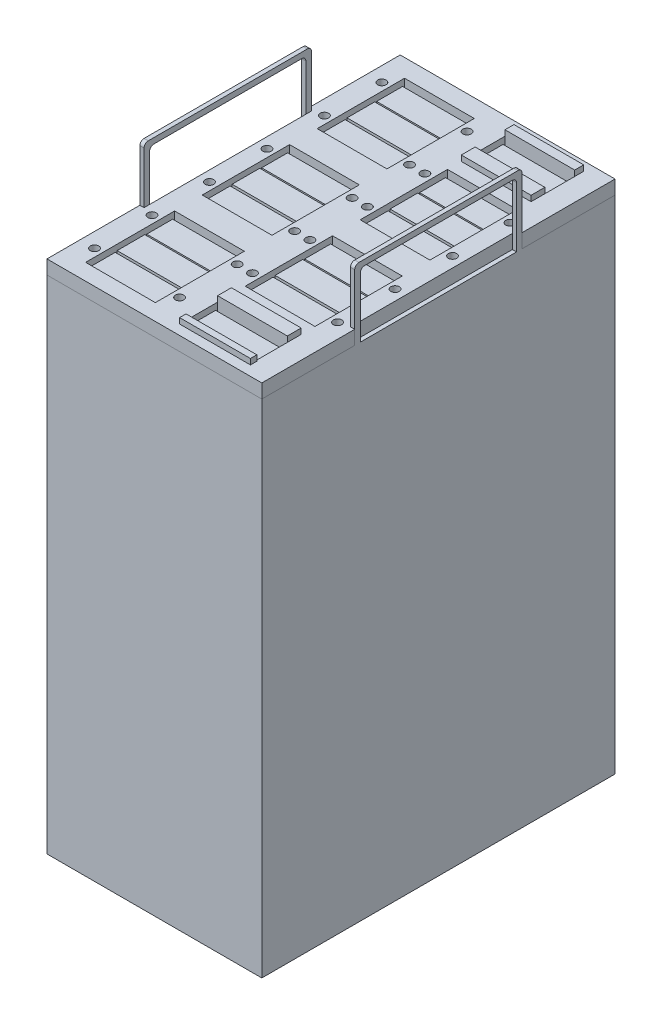
from build123d import *

# Parameters (mm, degrees)
SKETCH1_W                  = 77
SKETCH1_H                  = 126.6
SKETCH1_W_2                = 74
SKETCH1_H_2                = 123.6
BASE_BODY_DEPTH            = 179.7
SKETCH1_4_W                = 74
SKETCH1_4_H                = 123.6
BASE_FLOOR_DEPTH           = 2
FLOOR_HOLE_S_W             = 66.6
FLOOR_HOLE_S_H             = 116.2
FLOOR_HOLE_DEPTH           = 16
SKETCH2_W                  = 11
SKETCH2_H                  = 4.95
SKETCH2_H_2                = 4.35
SKETCH2_H_3                = 1.5
BOSS_EXTRUDE1_DEPTH        = 5
SKETCH2_3_W                = 11
SKETCH2_3_H                = 4.95
SKETCH2_3_H_2              = 4.35
BOSS_EXTRUDE2_DEPTH        = 5.7
SKETCH2_4_W                = 25
SKETCH2_4_H                = 9.3
BOSS_EXTRUDE3_DEPTH        = 2.8
LPATTERN2_COUNT            = 6
LPATTERN2_PITCH            = 20.6
LPATTERN2_2_COUNT          = 2
LPATTERN2_2_PITCH          = 36
SKETCH2_6_W                = 25
SKETCH2_6_H                = 9.9
BOSS_EXTRUDE4_DEPTH        = 5
LPATTERN3_COUNT            = 5
LPATTERN3_PITCH            = 20.6
LPATTERN3_2_COUNT          = 2
LPATTERN3_2_PITCH          = 36
SKETCH6_W                  = 25
SKETCH6_H                  = 9.9
CUT_EXTRUDE2_DEPTH         = 2
BOSS_EXTRUDE13_OUTLINE_W   = 25
BOSS_EXTRUDE13_OUTLINE_H   = 4.95
BOSS_EXTRUDE13_OUTLINE_W_2 = 25.382374023
BOSS_EXTRUDE13_OUTLINE_H_2 = 2.3
BOSS_EXTRUDE13_OUTLINE_H_3 = 3.225
BOSS_EXTRUDE13_DEPTH       = 2
CUT_EXTRUDE3_DEPTH         = 45
LPATTERN4_COUNT            = 6
LPATTERN4_PITCH            = 20.6
LPATTERN5_COUNT            = 2
LPATTERN5_PITCH            = 36
LPATTERN5_COUNT_DIR2       = 6
LPATTERN5_PITCH_DIR2       = 20.6
SKETCH11_3_R               = 1.5
BOSS_EXTRUDE14_DEPTH       = 10.7
SKETCH12_R                 = 1.5
BOSS_EXTRUDE15_DEPTH       = 10.8
SKETCH14_W                 = 1.5
SKETCH14_H                 = 2
BOSS_EXTRUDE16_DEPTH       = 25
SKETCH15_W                 = 1.5
SKETCH15_H                 = 2
BOSS_EXTRUDE17_DEPTH       = 56
FILLET2_R                  = 1.5
SKETCH16_W                 = 1.5
SKETCH16_H                 = 60
CUT_EXTRUDE4_DEPTH         = 5


# Read off the part's stored shape, not the designer's step: Boss-Extrude13
with BuildPart() as part:
    # Sketch1 → Base Body (new body)
    with BuildSketch(Plane(origin=(0, 0, 0), x_dir=(1, 0, 0), z_dir=(0, 1, 0))):
        with Locations((-26.13968254, -14.066666667)):
            Rectangle(SKETCH1_W, SKETCH1_H)
        with Locations((-26.13968254, -14.066666667)):
            Rectangle(SKETCH1_W_2, SKETCH1_H_2, mode=Mode.SUBTRACT)
    extrude(amount=BASE_BODY_DEPTH)

    # Sketch1<4> → Base Floor (add)
    with BuildSketch(Plane(origin=(0, 0, 0), x_dir=(1, 0, 0), z_dir=(0, 1, 0))):
        with Locations((-26.13968254, -14.066666667)):
            Rectangle(SKETCH1_4_W, SKETCH1_4_H)
    extrude(amount=BASE_FLOOR_DEPTH)

    # Floor Hole-S → Floor Hole (cut)
    with BuildSketch(Plane.XZ):
        with Locations((-26.13968254, 14.066666667)):
            Rectangle(FLOOR_HOLE_S_W, FLOOR_HOLE_S_H)
    extrude(amount=-FLOOR_HOLE_DEPTH, mode=Mode.SUBTRACT)

    # Sketch14 → Boss-Extrude16 (add)
    with BuildSketch(Plane(origin=(0, 179.7, 0), x_dir=(1, 0, 0), z_dir=(0, 1, 0))):
        with Locations((11.61031746, 14.933333333)):
            Rectangle(SKETCH14_W, SKETCH14_H)
        with Locations((11.61031746, -43.066666667)):
            Rectangle(SKETCH14_W, SKETCH14_H)
        with Locations((-63.88968254, 14.933333333)):
            Rectangle(SKETCH14_W, SKETCH14_H)
        with Locations((-63.88968254, -43.066666667)):
            Rectangle(SKETCH14_W, SKETCH14_H)
    extrude(amount=BOSS_EXTRUDE16_DEPTH)

    # Sketch15 → Boss-Extrude17 (add)
    with BuildSketch(Plane.XY.offset(-13.933333333)):
        with Locations((11.61031746, 203.7)):
            Rectangle(SKETCH15_W, SKETCH15_H)
        with Locations((-63.88968254, 203.7)):
            Rectangle(SKETCH15_W, SKETCH15_H)
    extrude(amount=BOSS_EXTRUDE17_DEPTH)

    # Fillet2
    fillet2_edges = [part.edges().sort_by_distance(p)[0] for p in [
        (11.61031746, 204.7, -15.933333333),
        (11.61031746, 204.7, 44.066666667),
        (-63.88968254, 204.7, -15.933333333),
        (-63.88968254, 204.7, 44.066666667),
        (11.61031746, 202.7, -13.933333333),
        (11.61031746, 202.7, 42.066666667),
        (-63.88968254, 202.7, -13.933333333),
        (-63.88968254, 202.7, 42.066666667),
    ]]
    fillet(fillet2_edges, radius=FILLET2_R)


with BuildPart() as body_2:
    # Sketch2 → Boss-Extrude1 (new body)
    with BuildSketch(Plane(origin=(0, 179.7, 0), x_dir=(1, 0, 0), z_dir=(0, 1, 0))):
        Polygon((-20.63968254, 42.783333333), (-31.63968254, 42.783333333), (-31.63968254, 42.083333333), (-31.63968254, 32.783333333), (-31.63968254, 32.083333333), (-31.63968254, 22.183333333), (-31.63968254, -71.516666667), (-20.63968254, -71.516666667), align=None)
        Polygon((10.86031746, 47.733333333), (-20.63968254, 47.733333333), (-20.63968254, 42.783333333), (4.36031746, 42.783333333), (4.36031746, -71.516666667), (-20.63968254, -71.516666667), (-20.63968254, -75.866666667), (10.86031746, -75.866666667), align=None)
        Polygon((-31.63968254, 42.783333333), (-31.63968254, 47.733333333), (-63.13968254, 47.733333333), (-63.13968254, -75.866666667), (-31.63968254, -75.866666667), (-31.63968254, -71.516666667), (-56.63968254, -71.516666667), (-56.63968254, 22.183333333), (-56.63968254, 32.083333333), (-56.63968254, 32.783333333), (-56.63968254, 42.083333333), (-56.63968254, 42.783333333), align=None)
        with Locations((-26.13968254, 45.258333333)):
            Rectangle(SKETCH2_W, SKETCH2_H)
        with Locations((-26.13968254, -73.691666667)):
            Rectangle(SKETCH2_W, SKETCH2_H_2)
        Polygon((-31.63968254, 49.233333333), (-64.63968254, 49.233333333), (-64.63968254, -77.366666667), (-31.63968254, -77.366666667), (-31.63968254, -75.866666667), (-63.13968254, -75.866666667), (-63.13968254, 47.733333333), (-31.63968254, 47.733333333), align=None)
        with Locations((-26.13968254, 48.483333333)):
            Rectangle(SKETCH2_W, SKETCH2_H_3)
        Polygon((12.36031746, 49.233333333), (-20.63968254, 49.233333333), (-20.63968254, 47.733333333), (10.86031746, 47.733333333), (10.86031746, -75.866666667), (-20.63968254, -75.866666667), (-20.63968254, -77.366666667), (12.36031746, -77.366666667), align=None)
        with Locations((-26.13968254, -76.616666667)):
            Rectangle(SKETCH2_W, SKETCH2_H_3)
    extrude(amount=BOSS_EXTRUDE1_DEPTH)

    # Sketch2<3> → Boss-Extrude2 (add)
    with BuildSketch(Plane(origin=(0, 179.7, 0), x_dir=(1, 0, 0), z_dir=(0, 1, 0))):
        Polygon((-31.63968254, 42.783333333), (-31.63968254, 47.733333333), (-63.13968254, 47.733333333), (-63.13968254, -75.866666667), (-31.63968254, -75.866666667), (-31.63968254, -71.516666667), (-56.63968254, -71.516666667), (-56.63968254, 22.183333333), (-56.63968254, 32.083333333), (-56.63968254, 32.783333333), (-56.63968254, 42.083333333), (-56.63968254, 42.783333333), align=None)
        Polygon((10.86031746, 47.733333333), (-20.63968254, 47.733333333), (-20.63968254, 42.783333333), (4.36031746, 42.783333333), (4.36031746, -71.516666667), (-20.63968254, -71.516666667), (-20.63968254, -75.866666667), (10.86031746, -75.866666667), align=None)
        Polygon((-20.63968254, 42.783333333), (-31.63968254, 42.783333333), (-31.63968254, 42.083333333), (-31.63968254, 32.783333333), (-31.63968254, 32.083333333), (-31.63968254, 22.183333333), (-31.63968254, -71.516666667), (-20.63968254, -71.516666667), align=None)
        with Locations((-26.13968254, 45.258333333)):
            Rectangle(SKETCH2_3_W, SKETCH2_3_H)
        with Locations((-26.13968254, -73.691666667)):
            Rectangle(SKETCH2_3_W, SKETCH2_3_H_2)
    extrude(amount=-BOSS_EXTRUDE2_DEPTH)


with BuildPart() as body_3:
    # Sketch2<4> → Boss-Extrude3 (new body)
    with BuildSketch(Plane(origin=(0, 179.7, 0), x_dir=(1, 0, 0), z_dir=(0, 1, 0))):
        with Locations((-44.13968254, 37.433333333)):
            Rectangle(SKETCH2_4_W, SKETCH2_4_H)
    extrude(amount=BOSS_EXTRUDE3_DEPTH)


with BuildPart() as lpattern2_1:
    # LPattern2: pattern copy
    add(body_3.part.moved(Location(Vector(0, 0, 1) * (1 * LPATTERN2_PITCH))))


with BuildPart() as lpattern2_2:
    # LPattern2: pattern copy
    add(body_3.part.moved(Location(Vector(0, 0, 1) * (2 * LPATTERN2_PITCH))))


with BuildPart() as lpattern2_3:
    # LPattern2: pattern copy
    add(body_3.part.moved(Location(Vector(0, 0, 1) * (3 * LPATTERN2_PITCH))))


with BuildPart() as lpattern2_4:
    # LPattern2: pattern copy
    add(body_3.part.moved(Location(Vector(0, 0, 1) * (4 * LPATTERN2_PITCH))))


with BuildPart() as lpattern2_5:
    # LPattern2: pattern copy
    add(body_3.part.moved(Location(Vector(0, 0, 1) * (5 * LPATTERN2_PITCH))))


with BuildPart() as lpattern2_2_1:
    # LPattern2 2: pattern copy
    add(body_3.part.moved(Location(Vector(1, 0, 0) * (1 * LPATTERN2_2_PITCH))))


with BuildPart() as lpattern2_2_2:
    # LPattern2 2: pattern copy
    add(lpattern2_1.part.moved(Location(Vector(1, 0, 0) * (1 * LPATTERN2_2_PITCH))))


with BuildPart() as lpattern2_2_3:
    # LPattern2 2: pattern copy
    add(lpattern2_2.part.moved(Location(Vector(1, 0, 0) * (1 * LPATTERN2_2_PITCH))))


with BuildPart() as lpattern2_2_4:
    # LPattern2 2: pattern copy
    add(lpattern2_3.part.moved(Location(Vector(1, 0, 0) * (1 * LPATTERN2_2_PITCH))))


with BuildPart() as lpattern2_2_5:
    # LPattern2 2: pattern copy
    add(lpattern2_4.part.moved(Location(Vector(1, 0, 0) * (1 * LPATTERN2_2_PITCH))))


with BuildPart() as lpattern2_2_6:
    # LPattern2 2: pattern copy
    add(lpattern2_5.part.moved(Location(Vector(1, 0, 0) * (1 * LPATTERN2_2_PITCH))))


with BuildPart() as body_15:
    # Sketch2<6> → Boss-Extrude4 (new body)
    with BuildSketch(Plane(origin=(0, 179.7, 0), x_dir=(1, 0, 0), z_dir=(0, 1, 0))):
        with Locations((-44.13968254, 27.133333333)):
            Rectangle(SKETCH2_6_W, SKETCH2_6_H)
    extrude(amount=BOSS_EXTRUDE4_DEPTH)


with BuildPart() as lpattern3_1:
    # LPattern3: pattern copy
    add(body_15.part.moved(Location(Vector(0, 0, 1) * (1 * LPATTERN3_PITCH))))


with BuildPart() as lpattern3_2:
    # LPattern3: pattern copy
    add(body_15.part.moved(Location(Vector(0, 0, 1) * (2 * LPATTERN3_PITCH))))


with BuildPart() as lpattern3_3:
    # LPattern3: pattern copy
    add(body_15.part.moved(Location(Vector(0, 0, 1) * (3 * LPATTERN3_PITCH))))


with BuildPart() as lpattern3_4:
    # LPattern3: pattern copy
    add(body_15.part.moved(Location(Vector(0, 0, 1) * (4 * LPATTERN3_PITCH))))


with BuildPart() as lpattern3_2_1:
    # LPattern3 2: pattern copy
    add(body_15.part.moved(Location(Vector(1, 0, 0) * (1 * LPATTERN3_2_PITCH))))


with BuildPart() as lpattern3_2_2:
    # LPattern3 2: pattern copy
    add(lpattern3_1.part.moved(Location(Vector(1, 0, 0) * (1 * LPATTERN3_2_PITCH))))


with BuildPart() as lpattern3_2_3:
    # LPattern3 2: pattern copy
    add(lpattern3_2.part.moved(Location(Vector(1, 0, 0) * (1 * LPATTERN3_2_PITCH))))


with BuildPart() as lpattern3_2_4:
    # LPattern3 2: pattern copy
    add(lpattern3_3.part.moved(Location(Vector(1, 0, 0) * (1 * LPATTERN3_2_PITCH))))


with BuildPart() as lpattern3_2_5:
    # LPattern3 2: pattern copy
    add(lpattern3_4.part.moved(Location(Vector(1, 0, 0) * (1 * LPATTERN3_2_PITCH))))


with BuildPart() as cut_extrude2_tool:
    # Sketch6 → Cut-Extrude2 (new body)
    with BuildSketch(Plane(origin=(0, 184.7, 0), x_dir=(1, 0, 0), z_dir=(0, 1, 0))):
        with Locations((-44.13968254, 27.133333333)):
            Rectangle(SKETCH6_W, SKETCH6_H)
        with Locations((-8.13968254, 6.533333333)):
            Rectangle(SKETCH6_W, SKETCH6_H)
        with Locations((-44.13968254, -14.066666667)):
            Rectangle(SKETCH6_W, SKETCH6_H)
        with Locations((-8.13968254, -34.666666667)):
            Rectangle(SKETCH6_W, SKETCH6_H)
        with Locations((-44.13968254, -55.266666667)):
            Rectangle(SKETCH6_W, SKETCH6_H)
    extrude(amount=-CUT_EXTRUDE2_DEPTH)


with BuildPart() as body_15_1:
    add(body_15.part)

    # Cut-Extrude2: cut by cut_extrude2_tool
    add(cut_extrude2_tool.part, mode=Mode.SUBTRACT)


with BuildPart() as lpattern3_2_6:
    add(lpattern3_2.part)

    # Cut-Extrude2: cut by cut_extrude2_tool
    add(cut_extrude2_tool.part, mode=Mode.SUBTRACT)


with BuildPart() as lpattern3_4_1:
    add(lpattern3_4.part)

    # Cut-Extrude2: cut by cut_extrude2_tool
    add(cut_extrude2_tool.part, mode=Mode.SUBTRACT)


with BuildPart() as lpattern3_2_2_1:
    add(lpattern3_2_2.part)

    # Cut-Extrude2: cut by cut_extrude2_tool
    add(cut_extrude2_tool.part, mode=Mode.SUBTRACT)


with BuildPart() as lpattern3_2_4_1:
    add(lpattern3_2_4.part)

    # Cut-Extrude2: cut by cut_extrude2_tool
    add(cut_extrude2_tool.part, mode=Mode.SUBTRACT)


with BuildPart() as body_3_1:
    add(body_3.part)

    # Combine4: union LPattern2_1, LPattern2_2, LPattern2_3, LPattern2_4, LPattern2_5, LPattern2 2_1, LPattern2 2_2, LPattern2 2_3, LPattern2 2_4, LPattern2 2_5, LPattern2 2_6, LPattern3_1, LPattern3_3, LPattern3 2_1, LPattern3 2_3, LPattern3 2_5, body 2
    add(lpattern2_1.part)
    add(lpattern2_2.part)
    add(lpattern2_3.part)
    add(lpattern2_4.part)
    add(lpattern2_5.part)
    add(lpattern2_2_1.part)
    add(lpattern2_2_2.part)
    add(lpattern2_2_3.part)
    add(lpattern2_2_4.part)
    add(lpattern2_2_5.part)
    add(lpattern2_2_6.part)
    add(lpattern3_1.part)
    add(lpattern3_3.part)
    add(lpattern3_2_1.part)
    add(lpattern3_2_3.part)
    add(lpattern3_2_5.part)
    add(body_2.part)


with BuildPart() as lpattern3_2_7:
    add(lpattern3_2_6.part)

    # Combine5: union LPattern3_4, LPattern3 2_2, LPattern3 2_4, body 3, body 15
    add(lpattern3_4_1.part)
    add(lpattern3_2_2_1.part)
    add(lpattern3_2_4_1.part)
    add(body_3_1.part)
    add(body_15_1.part)

    # Boss-Extrude13 outline → Boss-Extrude13 (add)
    with BuildSketch(Plane(origin=(0, 184.7, 0), x_dir=(1, 0, 0), z_dir=(0, 1, 0))):
        with Locations((-8.13968254, -57.741666667)):
            Rectangle(BOSS_EXTRUDE13_OUTLINE_W, BOSS_EXTRUDE13_OUTLINE_H)
        with Locations((-8.13968254, 29.608333333)):
            Rectangle(BOSS_EXTRUDE13_OUTLINE_W, BOSS_EXTRUDE13_OUTLINE_H)
        with Locations((-7.948495529, -72.666666667)):
            Rectangle(BOSS_EXTRUDE13_OUTLINE_W_2, BOSS_EXTRUDE13_OUTLINE_H_2)
        with Locations((-8.13968254, 44.395833333)):
            Rectangle(BOSS_EXTRUDE13_OUTLINE_W, BOSS_EXTRUDE13_OUTLINE_H_3)
    extrude(amount=BOSS_EXTRUDE13_DEPTH)

    # Sketch11 → Cut-Extrude3 (cut)
    with BuildSketch(Plane.XZ.offset(-174)):
        with BuildLine():
            ThreePointArc((-60.88968254, 65.566666667), (-59.38968254, 64.066666667), (-57.88968254, 65.566666667))
            Line((-57.88968254, 65.566666667), (-60.88968254, 65.566666667))
        make_face()
        with BuildLine():
            Line((-60.88968254, 65.566666667), (-57.88968254, 65.566666667))
            ThreePointArc((-57.88968254, 65.566666667), (-59.38968254, 67.066666667), (-60.88968254, 65.566666667))
        make_face()
        with BuildLine():
            ThreePointArc((-30.38968254, 65.566666667), (-28.88968254, 64.066666667), (-27.38968254, 65.566666667))
            Line((-27.38968254, 65.566666667), (-30.38968254, 65.566666667))
        make_face()
        with BuildLine():
            Line((-30.38968254, 65.566666667), (-27.38968254, 65.566666667))
            ThreePointArc((-27.38968254, 65.566666667), (-28.88968254, 67.066666667), (-30.38968254, 65.566666667))
        make_face()
    cut_extrude3 = extrude(amount=-CUT_EXTRUDE3_DEPTH, mode=Mode.SUBTRACT)

    # LPattern4: Cut-Extrude3 ×6
    with Locations(*[(0, 0, -i * LPATTERN4_PITCH) for i in range(1, LPATTERN4_COUNT)]):
        add(cut_extrude3, mode=Mode.SUBTRACT)

    # LPattern5: Cut-Extrude3 2 × 6
    with Locations(*[(i * LPATTERN5_PITCH, 0, -j * LPATTERN5_PITCH_DIR2) for i in range(LPATTERN5_COUNT) for j in range(LPATTERN5_COUNT_DIR2) if (i, j) != (0, 0)]):
        add(cut_extrude3, mode=Mode.SUBTRACT)

    # Sketch11<3> → Boss-Extrude14 (add)
    with BuildSketch(Plane.XZ.offset(-174)):
        with BuildLine():
            ThreePointArc((5.61031746, 65.566666667), (7.11031746, 64.066666667), (8.61031746, 65.566666667))
            Line((8.61031746, 65.566666667), (5.61031746, 65.566666667))
        make_face()
        with BuildLine():
            Line((5.61031746, 65.566666667), (8.61031746, 65.566666667))
            ThreePointArc((8.61031746, 65.566666667), (7.11031746, 67.066666667), (5.61031746, 65.566666667))
        make_face()
        with Locations((-23.38968254, 65.566666667)):
            Circle(SKETCH11_3_R)
    extrude(amount=-BOSS_EXTRUDE14_DEPTH)

    # Sketch12 → Boss-Extrude15 (add)
    with BuildSketch(Plane(origin=(0, 184.7, 0), x_dir=(1, 0, 0), z_dir=(0, 1, 0))):
        with Locations(Location((-23.38968254, 37.433333333, 0), (0, 0, 270))):
            Circle(SKETCH12_R)
        with Locations(Location((7.11031746, 37.433333333, 0), (0, 0, 270))):
            Circle(SKETCH12_R)
    extrude(amount=-BOSS_EXTRUDE15_DEPTH)

    # Sketch16 → Cut-Extrude4 (cut)
    with BuildSketch(Plane.XZ.offset(-179.7)):
        with Locations((-63.88968254, 14.066666667)):
            Rectangle(SKETCH16_W, SKETCH16_H)
        with Locations((11.61031746, 14.066666667)):
            Rectangle(SKETCH16_W, SKETCH16_H)
    extrude(amount=-CUT_EXTRUDE4_DEPTH, mode=Mode.SUBTRACT)


solid = Compound([part.part, lpattern3_2_7.part])
